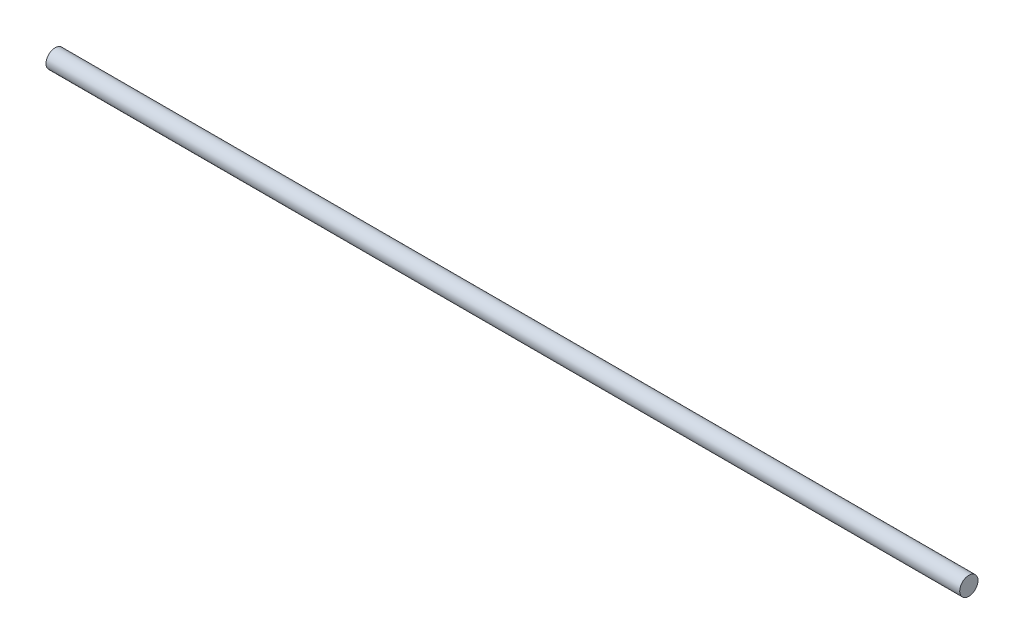
from build123d import *

# Parameters (mm, degrees)
SKETCH3_R           = 4
BOSS_EXTRUDE1_DEPTH = 400


with BuildPart() as part:
    # Sketch3 → Boss-Extrude1 (new body)
    with BuildSketch(Plane(origin=(0, 0, 0), x_dir=(0, 0, -1), z_dir=(1, 0, 0))):
        Circle(SKETCH3_R)
    extrude(amount=BOSS_EXTRUDE1_DEPTH)


solid = part.part
